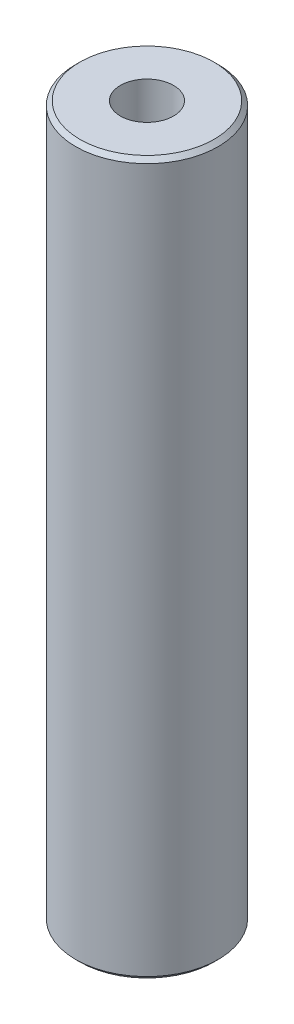
from build123d import *
from OCP.BRepFilletAPI import BRepFilletAPI_MakeChamfer

# Parameters (mm, degrees)
SKETCH1_R           = 60
BOSS_EXTRUDE1_DEPTH = 600
SKETCH2_R           = 22.382018282
CUT_EXTRUDE1_DEPTH  = 606.970296302
CHAMFER1_SIZE       = 3.516977225
CHAMFER1_SIZE2      = 3.545553869


with BuildPart() as part:
    # Sketch1 → Boss-Extrude1 (new body)
    with BuildSketch(Plane(origin=(0, 0, 0), x_dir=(1, 0, 0), z_dir=(0, 1, 0))):
        Circle(SKETCH1_R)
    extrude(amount=BOSS_EXTRUDE1_DEPTH)

    # Sketch2 → Cut-Extrude1 (cut, through all)
    with BuildSketch(Plane(origin=(0, 0, 0), x_dir=(1, 0, 0), z_dir=(0, 1, 0))):
        Circle(SKETCH2_R)
    extrude(amount=CUT_EXTRUDE1_DEPTH, mode=Mode.SUBTRACT)

    # Chamfer1: one chamfer whose edges measure the first distance from different faces: ONE call of the kernel's chamfer builder (chamfer() names one face for all edges)
    chamfer1_edges_1 = [part.edges().sort_by_distance(p)[0] for p in [
        (-60, 600, 0),
    ]]
    chamfer1_side_1 = [part.faces().sort_by_distance(p)[0] for p in [
        (-60, 300, 0),
    ]]
    chamfer1_edges_2 = [part.edges().sort_by_distance(p)[0] for p in [
        (-60, 0, 0),
    ]]
    chamfer1_side_2 = [part.faces().sort_by_distance(p)[0] for p in [
        (-58.302943725, 0, 0),
    ]]
    chamfer1 = BRepFilletAPI_MakeChamfer(part.part.solid().wrapped)
    for e in chamfer1_edges_1:
        chamfer1.Add(CHAMFER1_SIZE, CHAMFER1_SIZE2, e.wrapped, chamfer1_side_1[0].wrapped)  # the first distance lies on this face
    for e in chamfer1_edges_2:
        chamfer1.Add(CHAMFER1_SIZE, CHAMFER1_SIZE2, e.wrapped, chamfer1_side_2[0].wrapped)  # the first distance lies on this face
    add(Compound.cast(chamfer1.Shape()), mode=Mode.REPLACE)


solid = part.part
